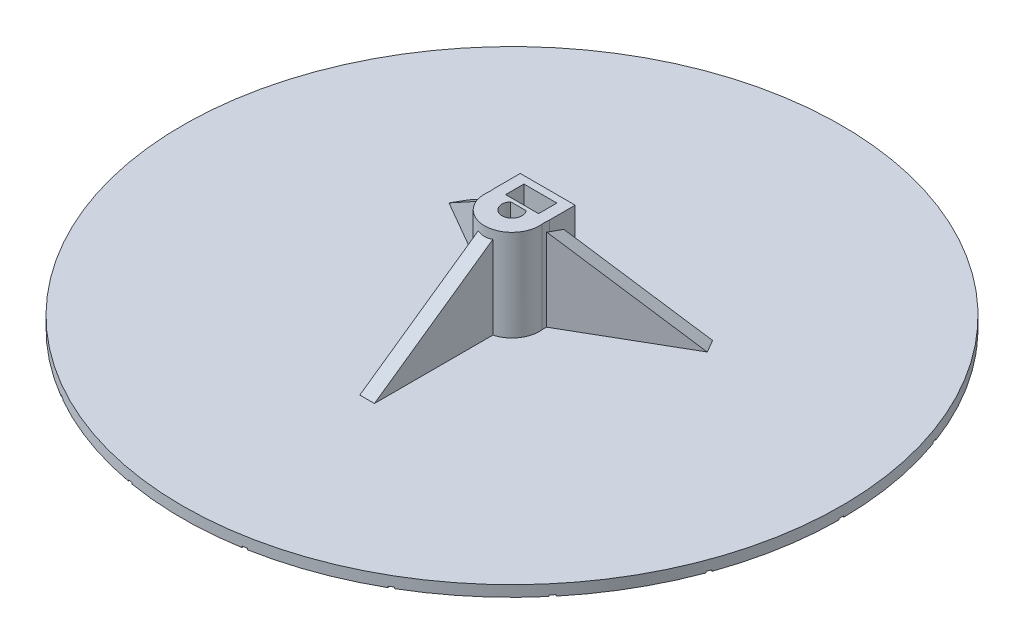
from build123d import *

# Parameters (mm, degrees)
SKETCH1_R                = 90
BOSS_EXTRUDE1_DEPTH      = 3
SKETCH2_R                = 7.5
BOSS_EXTRUDE2_DEPTH      = 25
RIB5_REACH               = 132.323
SKETCH3_WALL_W           = 306.218438134
SKETCH3_WALL_H           = 4
CIRPATTERN1_COUNT        = 3
BOSS_EXTRUDE3_DEPTH      = 4
BOSS_EXTRUDE3_DEPTH_BACK = 3
BOSS_EXTRUDE3_START      = -5
SKETCH5_W                = 15
SKETCH5_H                = 25
SKETCH5_R                = 2.75
CUT_EXTRUDE3_DEPTH       = 130.711217711
CUT_EXTRUDE3_DEPTH_BACK  = 1
SKETCH8_R                = 2.75
CUT_EXTRUDE4_DEPTH       = 8
CUT_EXTRUDE1_START       = -1
CUT_EXTRUDE1_DEPTH       = 5
SKETCH9_W                = 11.211365442
SKETCH9_H                = 11.7257459
SKETCH9_R                = 2.75
BOSS_EXTRUDE4_DEPTH      = 2
SKETCH10_W               = 9
SKETCH10_H               = 5
CUT_EXTRUDE5_DEPTH       = 10.453739
FILLET1_START            = 2
FILLET1_DEPTH            = 26
SKETCH11_R               = 3
CUT_EXTRUDE6_DEPTH       = 0.36
SKETCH12_R               = 0.6
CUT_EXTRUDE7_DEPTH       = 0.36


with BuildPart() as part:
    # Sketch1 → Boss-Extrude1 (new body)
    with BuildSketch(Plane(origin=(0, 0, 0), x_dir=(1, 0, 0), z_dir=(0, 1, 0))):
        with Locations(Location((0, 0, 0), (0, 0, 270))):
            Circle(SKETCH1_R)
    extrude(amount=BOSS_EXTRUDE1_DEPTH)

    # Sketch2 → Boss-Extrude2 (add)
    with BuildSketch(Plane(origin=(0, 3, 0), x_dir=(1, 0, 0), z_dir=(0, 1, 0))):
        with Locations(Location((0, 0, 0), (0, 0, 270))):
            Circle(SKETCH2_R)
        with BuildLine():
            Line((-2.121320344, 1.75), (2.121320344, 1.75))
            ThreePointArc((2.121320344, 1.75), (0, -2.75), (-2.121320344, 1.75))
        make_face(mode=Mode.SUBTRACT)
    extrude(amount=BOSS_EXTRUDE2_DEPTH)

    # Sketch3 wall → Rib5 (add, up to next)
    with BuildSketch(Plane(origin=(0, 13.5, 24.582023983), x_dir=(0, -0.573748677161, 0.819031412985), z_dir=(0, -0.819031412985, -0.573748677161)), mode=Mode.PRIVATE) as rib5_sk1:
        Rectangle(SKETCH3_WALL_W, SKETCH3_WALL_H)
    rib5_tool1 = extrude(rib5_sk1.sketch, amount=RIB5_REACH, mode=Mode.PRIVATE) - part.part
    rib5 = rib5_tool1.solids().sort_by_distance((0, 13.5, 24.582023983))[0]
    add(rib5)

    # CirPattern1: Rib5 ×3 about axis
    cirpattern1_axis = Axis((0, 0, 0), (0, 1, 0))
    for i in range(1, CIRPATTERN1_COUNT):
        add(rib5.rotate(cirpattern1_axis, i * 360 / CIRPATTERN1_COUNT))

    # Sketch5 → Boss-Extrude3 (add, two sides: drawn at the far end of the back side and taken through both)
    with BuildSketch(Plane.XY.offset(-1.75).offset(BOSS_EXTRUDE3_START - BOSS_EXTRUDE3_DEPTH_BACK)):
        with Locations((0, 15.5)):
            Rectangle(SKETCH5_W, SKETCH5_H)
        with Locations(Location((0, 20, 0), (0, 0, 90))):
            Circle(SKETCH5_R, mode=Mode.SUBTRACT)
    extrude(amount=BOSS_EXTRUDE3_DEPTH + BOSS_EXTRUDE3_DEPTH_BACK)

    # Sketch7 → Cut-Extrude3 (cut, two sides: drawn at the far end of the back side and taken through both)
    with BuildSketch(Plane(origin=(0, 3, 0), x_dir=(1, 0, 0), z_dir=(0, 1, 0)).offset(-CUT_EXTRUDE3_DEPTH_BACK)):
        with BuildLine():
            Line((-2.121320344, 1.75), (2.121320344, 1.75))
            ThreePointArc((2.121320344, 1.75), (0, -2.75), (-2.121320344, 1.75))
        make_face()
    extrude(amount=CUT_EXTRUDE3_DEPTH + CUT_EXTRUDE3_DEPTH_BACK, mode=Mode.SUBTRACT)

    # Sketch8 → Cut-Extrude4 (cut)
    with BuildSketch(Plane(origin=(0, 0, -9.75), x_dir=(-1, 0, 0), z_dir=(0, 0, -1))):
        with Locations(Location((0, 20, 0), (0, 0, 39.521196359))):
            Circle(SKETCH8_R)
    extrude(amount=-CUT_EXTRUDE4_DEPTH, mode=Mode.SUBTRACT)

    # Sketch4 → Cut-Extrude1 (cut)
    with BuildSketch(Plane.XY.offset(-1.75).offset(CUT_EXTRUDE1_START)):
        Polygon((0, 24.907477288), (-4.25, 22.453738644), (-4.25, 17.546261356), (0, 15.092522712), (4.25, 17.546261356), (4.25, 22.453738644), align=None)
    extrude(amount=-CUT_EXTRUDE1_DEPTH, mode=Mode.SUBTRACT)

    # Sketch9 → Boss-Extrude4 (add)
    with BuildSketch(Plane(origin=(0, 0, -9.75), x_dir=(-1, 0, 0), z_dir=(0, 0, -1))):
        with Locations((0, 20)):
            Rectangle(SKETCH9_W, SKETCH9_H)
        with Locations(Location((0, 20, 0), (0, 0, 180))):
            Circle(SKETCH9_R, mode=Mode.SUBTRACT)
    extrude(amount=-BOSS_EXTRUDE4_DEPTH)

    # Sketch10 → Cut-Extrude5 (cut)
    with BuildSketch(Plane(origin=(0, 28, 0), x_dir=(1, 0, 0), z_dir=(0, 1, 0))):
        with Locations((0, 5.25)):
            Rectangle(SKETCH10_W, SKETCH10_H)
    extrude(amount=-CUT_EXTRUDE5_DEPTH, mode=Mode.SUBTRACT)

    # Fillet1: read off the stored shape, not the designer's step
    # Fillet1 outline → Fillet1 (add)
    with BuildSketch(Plane(origin=(0, 0, 0), x_dir=(1, 0, 0), z_dir=(0, 1, 0)).offset(FILLET1_START)):
        with BuildLine():
            ThreePointArc((-7.46988647, 0.671413522), (-7.29814404, 1.728321024), (-6.977642868, 2.75))
            Line((-6.977642868, 2.75), (-7.5, 2.75))
            ThreePointArc((-7.5, 2.75), (-7.430784372, 1.711491388), (-7.46988647, 0.671413522))
        make_face()
        with BuildLine():
            Line((7.5, 2.75), (6.977642868, 2.75))
            ThreePointArc((6.977642868, 2.75), (7.29814404, 1.728321024), (7.46988647, 0.671413522))
            ThreePointArc((7.46988647, 0.671413522), (7.430784372, 1.711491388), (7.5, 2.75))
        make_face()
    extrude(amount=FILLET1_DEPTH)

    # Sketch11 → Cut-Extrude6 (cut)
    with BuildSketch(Plane.XZ):
        with BuildLine():
            Line((-89.997579967, 0.66), (-3.743046001, 0.66))
            Line((-3.743046001, 0.66), (-84.795795079, 30.16078807))
            ThreePointArc((-84.795795079, 30.16078807), (-84.572335871, 30.781812899), (-84.344328489, 31.401182329))
            Line((-84.344328489, 31.401182329), (-3.291579412, 1.900394259))
            Line((-3.291579412, 1.900394259), (-69.366385851, 57.343739972))
            ThreePointArc((-69.366385851, 57.343739972), (-68.943999881, 57.850884872), (-68.517906206, 58.354918637))
            Line((-68.517906206, 58.354918637), (-2.443099767, 2.911572924))
            Line((-2.443099767, 2.911572924), (-45.57036675, 77.610190531))
            ThreePointArc((-45.57036675, 77.610190531), (-45, 77.942286341), (-44.427213217, 78.270190531))
            Line((-44.427213217, 78.270190531), (-1.299946234, 3.571572924))
            Line((-1.299946234, 3.571572924), (-16.277888873, 88.515706707))
            ThreePointArc((-16.277888873, 88.515706707), (-15.62833599, 88.632697771), (-14.977942639, 88.744922302))
            Line((-14.977942639, 88.744922302), (0, 3.800788519))
            Line((0, 3.800788519), (14.977942639, 88.744922302))
            ThreePointArc((14.977942639, 88.744922302), (15.62833599, 88.632697771), (16.277888873, 88.515706707))
            Line((16.277888873, 88.515706707), (1.299946234, 3.571572924))
            Line((1.299946234, 3.571572924), (44.427213217, 78.270190531))
            ThreePointArc((44.427213217, 78.270190531), (45, 77.942286341), (45.57036675, 77.610190531))
            Line((45.57036675, 77.610190531), (2.443099767, 2.911572924))
            Line((2.443099767, 2.911572924), (68.517906206, 58.354918637))
            ThreePointArc((68.517906206, 58.354918637), (68.943999881, 57.850884872), (69.366385851, 57.343739972))
            Line((69.366385851, 57.343739972), (3.291579412, 1.900394259))
            Line((3.291579412, 1.900394259), (84.344328489, 31.401182329))
            ThreePointArc((84.344328489, 31.401182329), (84.572335871, 30.781812899), (84.795795079, 30.16078807))
            Line((84.795795079, 30.16078807), (3.743046001, 0.66))
            Line((3.743046001, 0.66), (89.997579967, 0.66))
            ThreePointArc((89.997579967, 0.66), (90, 0), (89.997579967, -0.66))
            Line((89.997579967, -0.66), (3.743046001, -0.66))
            Line((3.743046001, -0.66), (84.795795079, -30.16078807))
            ThreePointArc((84.795795079, -30.16078807), (84.572335871, -30.781812899), (84.344328489, -31.401182329))
            Line((84.344328489, -31.401182329), (3.291579412, -1.900394259))
            Line((3.291579412, -1.900394259), (69.366385851, -57.343739972))
            ThreePointArc((69.366385851, -57.343739972), (68.943999881, -57.850884872), (68.517906206, -58.354918637))
            Line((68.517906206, -58.354918637), (2.443099767, -2.911572924))
            Line((2.443099767, -2.911572924), (45.57036675, -77.610190531))
            ThreePointArc((45.57036675, -77.610190531), (45, -77.942286341), (44.427213217, -78.270190531))
            Line((44.427213217, -78.270190531), (1.299946234, -3.571572924))
            Line((1.299946234, -3.571572924), (16.277888873, -88.515706707))
            ThreePointArc((16.277888873, -88.515706707), (15.62833599, -88.632697771), (14.977942639, -88.744922302))
            Line((14.977942639, -88.744922302), (0, -3.800788519))
            Line((0, -3.800788519), (-14.977942639, -88.744922302))
            ThreePointArc((-14.977942639, -88.744922302), (-15.62833599, -88.632697771), (-16.277888873, -88.515706707))
            Line((-16.277888873, -88.515706707), (-1.299946234, -3.571572924))
            Line((-1.299946234, -3.571572924), (-44.427213217, -78.270190531))
            ThreePointArc((-44.427213217, -78.270190531), (-45, -77.942286341), (-45.57036675, -77.610190531))
            Line((-45.57036675, -77.610190531), (-2.443099767, -2.911572924))
            Line((-2.443099767, -2.911572924), (-68.517906206, -58.354918637))
            ThreePointArc((-68.517906206, -58.354918637), (-68.943999881, -57.850884872), (-69.366385851, -57.343739972))
            Line((-69.366385851, -57.343739972), (-3.291579412, -1.900394259))
            Line((-3.291579412, -1.900394259), (-84.344328489, -31.401182329))
            ThreePointArc((-84.344328489, -31.401182329), (-84.572335871, -30.781812899), (-84.795795079, -30.16078807))
            Line((-84.795795079, -30.16078807), (-3.743046001, -0.66))
            Line((-3.743046001, -0.66), (-89.997579967, -0.66))
            ThreePointArc((-89.997579967, -0.66), (-90, 0), (-89.997579967, 0.66))
        make_face()
        with Locations(Location((0, 0, 0), (0, 0, 270))):
            Circle(SKETCH11_R, mode=Mode.SUBTRACT)
    extrude(amount=-CUT_EXTRUDE6_DEPTH, mode=Mode.SUBTRACT)

    # Sketch12 → Cut-Extrude7 (cut)
    with BuildSketch(Plane.XZ):
        with Locations(Location((0, 0, 0), (0, 0, 270))):
            Circle(SKETCH12_R)
    extrude(amount=-CUT_EXTRUDE7_DEPTH, mode=Mode.SUBTRACT)


solid = part.part
